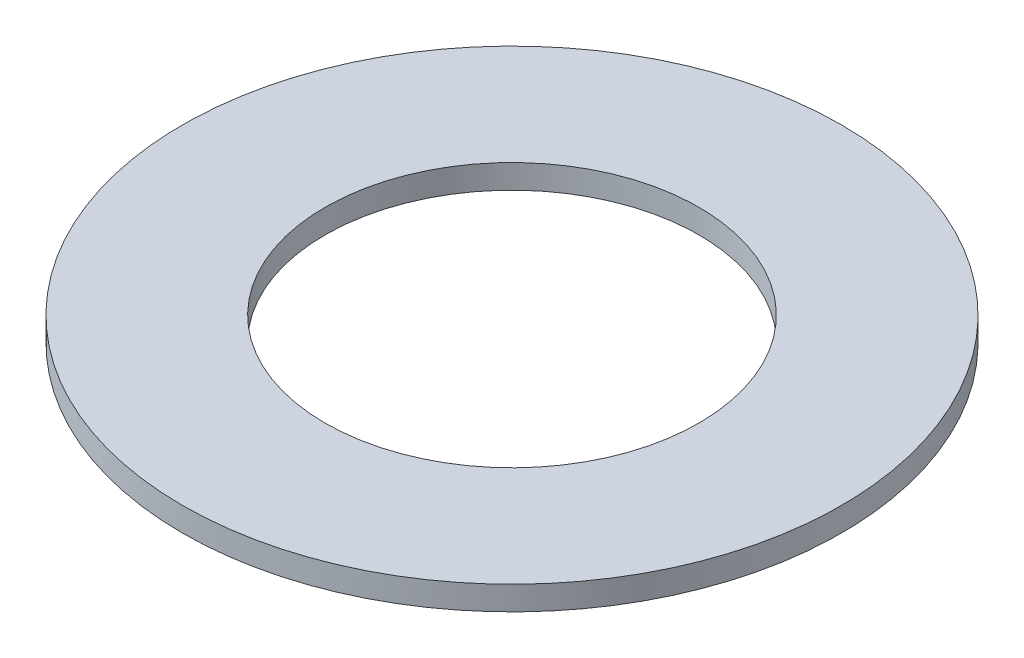
from build123d import *

# Parameters (mm, degrees)
SKETCH1_R           = 34.925
BOSS_EXTRUDE1_DEPTH = 2.54
SKETCH2_R           = 19.812
CUT_EXTRUDE1_DEPTH  = 50.456676496


with BuildPart() as part:
    # Sketch1 → Boss-Extrude1 (new body)
    with BuildSketch(Plane(origin=(0, 0, 0), x_dir=(1, 0, 0), z_dir=(0, 1, 0))):
        Circle(SKETCH1_R)
    extrude(amount=BOSS_EXTRUDE1_DEPTH)

    # Sketch2 → Cut-Extrude1 (cut, through all)
    with BuildSketch(Plane(origin=(0, 2.54, 0), x_dir=(1, 0, 0), z_dir=(0, 1, 0))):
        Circle(SKETCH2_R)
    extrude(amount=-CUT_EXTRUDE1_DEPTH, mode=Mode.SUBTRACT)


solid = part.part
